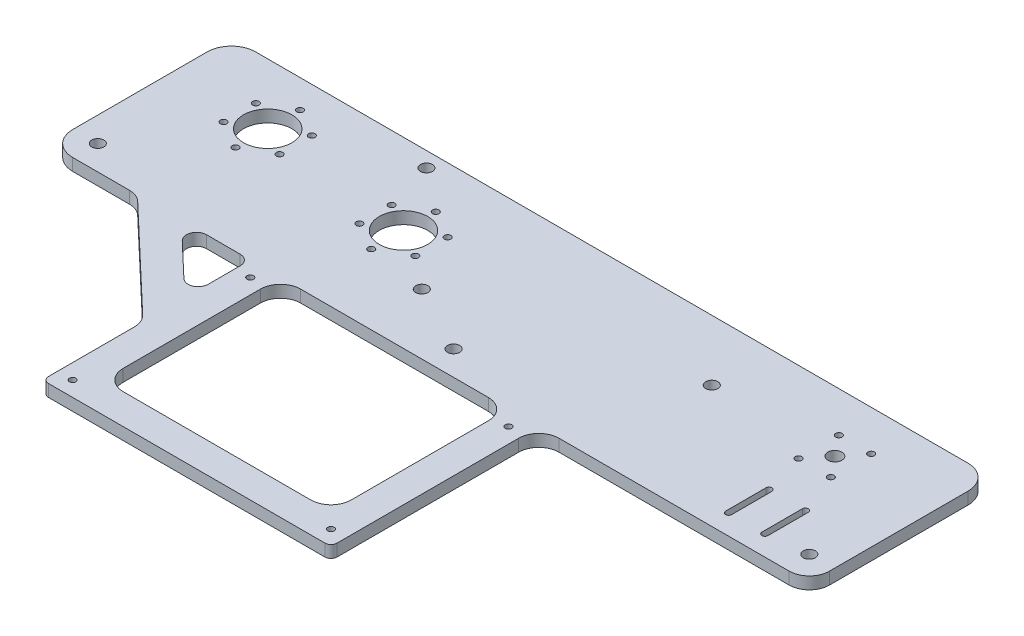
from build123d import *

# Parameters (mm, degrees)
ESBO_O1_R                = 1.6
ESBO_O1_R_2              = 3
ESBO_O1_R_3              = 12
ESBO_O1_R_4              = 3.5
RESSALTO_EXTRUS_O1_DEPTH = 6


with BuildPart() as part:
    # Esboço1 → Ressalto-extrusão1 (new body)
    with BuildSketch(Plane(origin=(0, 0, 0), x_dir=(1, 0, 0), z_dir=(0, 1, 0))):
        with BuildLine():
            Line((-85.527922956, -153.648697641), (51.472077044, -153.648697641))
            ThreePointArc((51.472077044, -153.648697641), (53.593397388, -152.770017984), (54.472077044, -150.648697641))
            Line((54.472077044, -150.648697641), (54.472077044, -108.102521344))
            Line((54.472077044, -108.102521344), (54.472077044, -60.648697641))
            ThreePointArc((54.472077044, -60.648697641), (57.401009232, -53.577629829), (64.472077044, -50.648697641))
            Line((64.472077044, -50.648697641), (178.527922956, -50.648697641))
            ThreePointArc((178.527922956, -50.648697641), (185.598990768, -47.719765453), (188.527922956, -40.648697641))
            Line((188.527922956, -40.648697641), (188.527922956, 28))
            ThreePointArc((188.527922956, 28), (185.01320433, 36.485281374), (176.527922956, 40))
            Line((176.527922956, 40), (-176.527922956, 40))
            ThreePointArc((-176.527922956, 40), (-185.01320433, 36.485281374), (-188.527922956, 28))
            Line((-188.527922956, 28), (-188.527922956, -38.648697641))
            ThreePointArc((-188.527922956, -38.648697641), (-185.01320433, -47.133979015), (-176.527922956, -50.648697641))
            Line((-176.527922956, -50.648697641), (-148.465622565, -50.648697641))
            ThreePointArc((-148.465622565, -50.648697641), (-144.756883762, -51.361865216), (-141.57713541, -53.399646343))
            Line((-141.57713541, -53.399646343), (-91.639435801, -100.853470046))
            ThreePointArc((-91.639435801, -100.853470046), (-89.338666415, -104.158213518), (-88.527922956, -108.102521344))
            Line((-88.527922956, -108.102521344), (-88.527922956, -150.648697641))
            ThreePointArc((-88.527922956, -150.648697641), (-87.649243299, -152.770017984), (-85.527922956, -153.648697641))
        make_face()
        with Locations((-81.027922956, -58.148697641)):
            Circle(ESBO_O1_R, mode=Mode.SUBTRACT)
        with Locations((-81.027922956, -146.148697641)):
            Circle(ESBO_O1_R, mode=Mode.SUBTRACT)
        with Locations((46.972077044, -58.148697641)):
            Circle(ESBO_O1_R, mode=Mode.SUBTRACT)
        with Locations((46.972077044, -146.148697641)):
            Circle(ESBO_O1_R, mode=Mode.SUBTRACT)
        with Locations((176.311042956, -38.431817641)):
            Circle(ESBO_O1_R_2, mode=Mode.SUBTRACT)
        with Locations((0, -38.431817641)):
            Circle(ESBO_O1_R_2, mode=Mode.SUBTRACT)
        with Locations((-140.527922956, 10)):
            Circle(ESBO_O1_R_3, mode=Mode.SUBTRACT)
        with Locations((-140.527922956, -6)):
            Circle(ESBO_O1_R, mode=Mode.SUBTRACT)
        with Locations((-154.384329416, 2)):
            Circle(ESBO_O1_R, mode=Mode.SUBTRACT)
        with Locations((-154.384329416, 18)):
            Circle(ESBO_O1_R, mode=Mode.SUBTRACT)
        with Locations((-84.367438628, 32.5)):
            Circle(ESBO_O1_R_2, mode=Mode.SUBTRACT)
        with Locations((-176.311042956, -38.431817641)):
            Circle(ESBO_O1_R_2, mode=Mode.SUBTRACT)
        with Locations((140.527922956, 10)):
            Circle(ESBO_O1_R_4, mode=Mode.SUBTRACT)
        with Locations((148.527922956, 0)):
            Circle(ESBO_O1_R, mode=Mode.SUBTRACT)
        with Locations((148.527922956, 20)):
            Circle(ESBO_O1_R, mode=Mode.SUBTRACT)
        with Locations((132.527922956, 0)):
            Circle(ESBO_O1_R, mode=Mode.SUBTRACT)
        with Locations((132.527922956, 20)):
            Circle(ESBO_O1_R, mode=Mode.SUBTRACT)
        with Locations((-140.527922956, 26)):
            Circle(ESBO_O1_R, mode=Mode.SUBTRACT)
        with Locations((-126.671516495, 18)):
            Circle(ESBO_O1_R, mode=Mode.SUBTRACT)
        with Locations((-126.671516495, 2)):
            Circle(ESBO_O1_R, mode=Mode.SUBTRACT)
        with Locations((-63.240442956, -16)):
            Circle(ESBO_O1_R, mode=Mode.SUBTRACT)
        with Locations((-77.096849416, -8)):
            Circle(ESBO_O1_R, mode=Mode.SUBTRACT)
        with Locations((-77.096849416, 8)):
            Circle(ESBO_O1_R, mode=Mode.SUBTRACT)
        with Locations((-63.240442956, 16)):
            Circle(ESBO_O1_R, mode=Mode.SUBTRACT)
        with Locations((-49.384036495, 8)):
            Circle(ESBO_O1_R, mode=Mode.SUBTRACT)
        with Locations((-49.384036495, -8)):
            Circle(ESBO_O1_R, mode=Mode.SUBTRACT)
        with Locations((-63.240442956, 0)):
            Circle(ESBO_O1_R_3, mode=Mode.SUBTRACT)
        with Locations((-33.527922956, -20.648697641)):
            Circle(ESBO_O1_R_2, mode=Mode.SUBTRACT)
        with Locations((79.527922956, 10)):
            Circle(ESBO_O1_R_2, mode=Mode.SUBTRACT)
        with BuildLine():
            Line((-110.176410786, -50.648697641), (-93.527922956, -50.648697641))
            ThreePointArc((-93.527922956, -50.648697641), (-89.99238905, -52.113163735), (-88.527922956, -55.648697641))
            Line((-88.527922956, -55.648697641), (-88.527922956, -71.469098112))
            ThreePointArc((-88.527922956, -71.469098112), (-91.555769043, -76.063726382), (-96.972166533, -75.09362376))
            Line((-96.972166533, -75.09362376), (-113.620654363, -59.27322329))
            ThreePointArc((-113.620654363, -59.27322329), (-114.819826998, -53.794328239), (-110.176410786, -50.648697641))
        make_face(mode=Mode.SUBTRACT)
        with BuildLine():
            Line((39.472077044, -60.648697641), (39.472077044, -128.648697641))
            ThreePointArc((39.472077044, -128.648697641), (36.543144856, -135.719765453), (29.472077044, -138.648697641))
            Line((29.472077044, -138.648697641), (-63.527922956, -138.648697641))
            ThreePointArc((-63.527922956, -138.648697641), (-70.598990768, -135.719765453), (-73.527922956, -128.648697641))
            Line((-73.527922956, -128.648697641), (-73.527922956, -60.648697641))
            ThreePointArc((-73.527922956, -60.648697641), (-70.598990768, -53.577629829), (-63.527922956, -50.648697641))
            Line((-63.527922956, -50.648697641), (29.472077044, -50.648697641))
            ThreePointArc((29.472077044, -50.648697641), (36.543144856, -53.577629829), (39.472077044, -60.648697641))
        make_face(mode=Mode.SUBTRACT)
        with BuildLine():
            Line((155.027922956, -40.648697641), (155.027922956, -20.648697641))
            ThreePointArc((155.027922956, -20.648697641), (156.527922956, -19.148697641), (158.027922956, -20.648697641))
            Line((158.027922956, -20.648697641), (158.027922956, -40.648697641))
            ThreePointArc((158.027922956, -40.648697641), (156.527922956, -42.148697641), (155.027922956, -40.648697641))
        make_face(mode=Mode.SUBTRACT)
        with BuildLine():
            Line((140.027922956, -40.648697641), (140.027922956, -20.648697641))
            ThreePointArc((140.027922956, -20.648697641), (138.527922956, -19.148697641), (137.027922956, -20.648697641))
            Line((137.027922956, -20.648697641), (137.027922956, -40.648697641))
            ThreePointArc((137.027922956, -40.648697641), (138.527922956, -42.148697641), (140.027922956, -40.648697641))
        make_face(mode=Mode.SUBTRACT)
    extrude(amount=-RESSALTO_EXTRUS_O1_DEPTH)


solid = part.part
